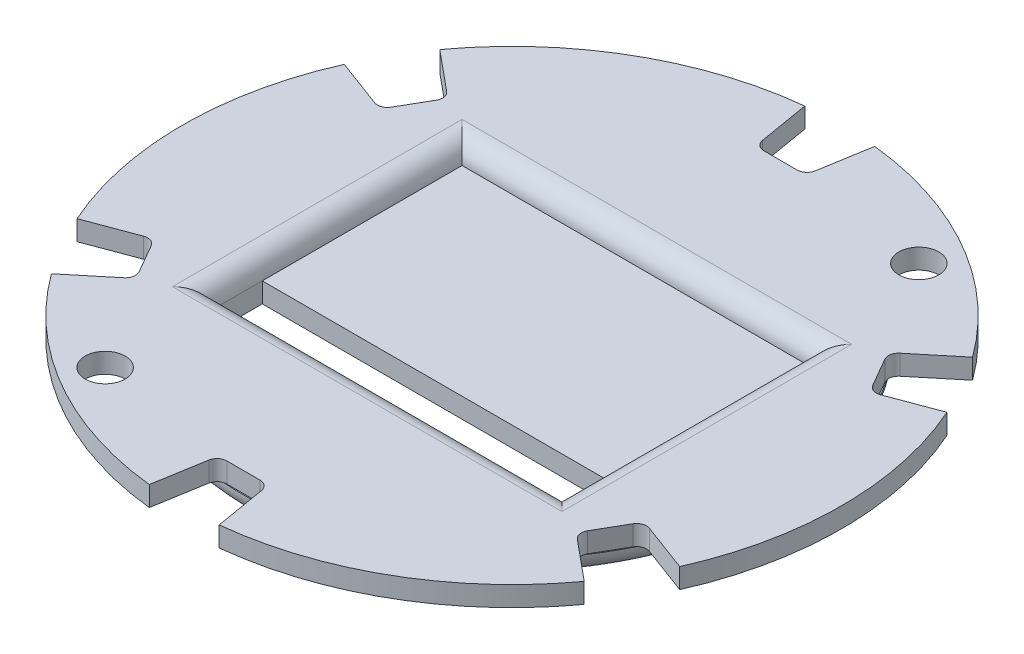
from build123d import *

# Parameters (mm, degrees)
SKETCH1_R               = 33
BOSS_EXTRUDE1_DEPTH     = 2
SKETCH5_R               = 27
BOSS_EXTRUDE2_DEPTH     = 2
SKETCH7_W               = 35
SKETCH7_H               = 25
CUT_EXTRUDE2_DEPTH      = 2
FILLET5_R               = 2
CUT_EXTRUDE3_DEPTH      = 47.840153715
CUT_EXTRUDE3_DEPTH_BACK = 47.840153715
SKETCH8_W               = 35
SKETCH8_H               = 5
FILLET3_R               = 2
SKETCH6_R               = 2
CUT_EXTRUDE4_DEPTH      = 10


with BuildPart() as part:
    # Sketch1 → Boss-Extrude1 (new body)
    with BuildSketch(Plane(origin=(0, 0, 0), x_dir=(1, 0, 0), z_dir=(0, 1, 0))):
        with Locations(Location((0, 0, 0), (0, 0, 270))):
            Circle(SKETCH1_R)
    extrude(amount=BOSS_EXTRUDE1_DEPTH)

    # Sketch5 → Boss-Extrude2 (add)
    with BuildSketch(Plane.XZ):
        with Locations(Location((0, 0, 0), (0, 0, 270))):
            Circle(SKETCH5_R)
    extrude(amount=BOSS_EXTRUDE2_DEPTH)

    # Sketch7 → Cut-Extrude2 (cut)
    with BuildSketch(Plane(origin=(0, 2, 0), x_dir=(1, 0, 0), z_dir=(0, 1, 0))):
        Rectangle(SKETCH7_W, SKETCH7_H)
    extrude(amount=-CUT_EXTRUDE2_DEPTH, mode=Mode.SUBTRACT)

    # Fillet5
    fillet5_edges = [part.edges().sort_by_distance(p)[0] for p in [
        (0, -2, 27),
    ]]
    fillet(fillet5_edges, radius=FILLET5_R - 0.0001)  # a hair under: the kernel refuses the full size

    # Sketch8 → Cut-Extrude3 (cut, two sides: drawn at the far end of the back side and taken through both)
    with BuildSketch(Plane(origin=(0, 2, 0), x_dir=(1, 0, 0), z_dir=(0, 1, 0)).offset(-CUT_EXTRUDE3_DEPTH_BACK)):
        with Locations((0, -10)):
            Rectangle(SKETCH8_W, SKETCH8_H)
    extrude(amount=CUT_EXTRUDE3_DEPTH + CUT_EXTRUDE3_DEPTH_BACK, mode=Mode.SUBTRACT)

    # Fillet3
    fillet3_edges = [part.edges().sort_by_distance(p)[0] for p in [
        (0, 2, 12.5),
        (-17.5, 2, 0),
        (0, 2, -12.5),
        (17.5, 2, 0),
    ]]
    fillet(fillet3_edges, radius=FILLET3_R - 0.0001)  # a hair under: the kernel refuses the full size

    # Sketch6 → Cut-Extrude4 (cut)
    with BuildSketch(Plane.XZ):
        with BuildLine():
            ThreePointArc((3.5, 32.813869019), (0, 33), (-3.5, 32.813869019))
            Line((-3.5, 32.813869019), (-2.640595233, 27.71772001))
            ThreePointArc((-2.640595233, 27.71772001), (-2.300161408, 27.12037077), (-1.654518359, 26.884010118))
            Line((-1.654518359, 26.884010118), (1.654518359, 26.884010118))
            ThreePointArc((1.654518359, 26.884010118), (2.300161408, 27.12037077), (2.640595233, 27.71772001))
            Line((2.640595233, 27.71772001), (3.5, 32.813869019))
        make_face()
        with BuildLine():
            Line((25.32454728, 11.572037452), (30.167644167, 13.375845596))
            ThreePointArc((30.167644167, 13.375845596), (28.578838325, 16.5), (26.667644167, 19.438023423))
            Line((26.667644167, 19.438023423), (22.683952047, 16.145682558))
            ThreePointArc((22.683952047, 16.145682558), (22.336849342, 15.552183597), (22.454976538, 14.874859989))
            Line((22.454976538, 14.874859989), (24.109494897, 12.009150128))
            ThreePointArc((24.109494897, 12.009150128), (24.637010751, 11.568187173), (25.32454728, 11.572037452))
        make_face()
        with Locations(Location((-15.850338446, 24.880047651, 0), (0, 0, 270))):
            Circle(SKETCH6_R)
        with BuildLine():
            Line((-30.167644167, 13.375845596), (-25.32454728, 11.572037452))
            ThreePointArc((-25.32454728, 11.572037452), (-24.637010751, 11.568187173), (-24.109494897, 12.009150128))
            Line((-24.109494897, 12.009150128), (-22.454976538, 14.874859989))
            ThreePointArc((-22.454976538, 14.874859989), (-22.336849342, 15.552183597), (-22.683952047, 16.145682558))
            Line((-22.683952047, 16.145682558), (-26.667644167, 19.438023423))
            ThreePointArc((-26.667644167, 19.438023423), (-28.578838325, 16.5), (-30.167644167, 13.375845596))
        make_face()
        with BuildLine():
            Line((22.683952047, -16.145682558), (26.667644167, -19.438023423))
            ThreePointArc((26.667644167, -19.438023423), (28.578838325, -16.5), (30.167644167, -13.375845596))
            Line((30.167644167, -13.375845596), (25.32454728, -11.572037452))
            ThreePointArc((25.32454728, -11.572037452), (24.637010751, -11.568187173), (24.109494897, -12.009150128))
            Line((24.109494897, -12.009150128), (22.454976538, -14.874859989))
            ThreePointArc((22.454976538, -14.874859989), (22.336849342, -15.552183597), (22.683952047, -16.145682558))
        make_face()
        with Locations(Location((15.850338446, -24.880047651, 0), (0, 0, 270))):
            Circle(SKETCH6_R)
        with BuildLine():
            Line((-26.667644167, -19.438023423), (-22.683952047, -16.145682558))
            ThreePointArc((-22.683952047, -16.145682558), (-22.336849342, -15.552183597), (-22.454976538, -14.874859989))
            Line((-22.454976538, -14.874859989), (-24.109494897, -12.009150128))
            ThreePointArc((-24.109494897, -12.009150128), (-24.637010751, -11.568187173), (-25.32454728, -11.572037452))
            Line((-25.32454728, -11.572037452), (-30.167644167, -13.375845596))
            ThreePointArc((-30.167644167, -13.375845596), (-28.578838325, -16.5), (-26.667644167, -19.438023423))
        make_face()
        with BuildLine():
            Line((-2.640595233, -27.71772001), (-3.5, -32.813869019))
            ThreePointArc((-3.5, -32.813869019), (0, -33), (3.5, -32.813869019))
            Line((3.5, -32.813869019), (2.640595233, -27.71772001))
            ThreePointArc((2.640595233, -27.71772001), (2.300161408, -27.12037077), (1.654518359, -26.884010118))
            Line((1.654518359, -26.884010118), (-1.654518359, -26.884010118))
            ThreePointArc((-1.654518359, -26.884010118), (-2.300161408, -27.12037077), (-2.640595233, -27.71772001))
        make_face()
    extrude(amount=-CUT_EXTRUDE4_DEPTH, mode=Mode.SUBTRACT)


solid = part.part
